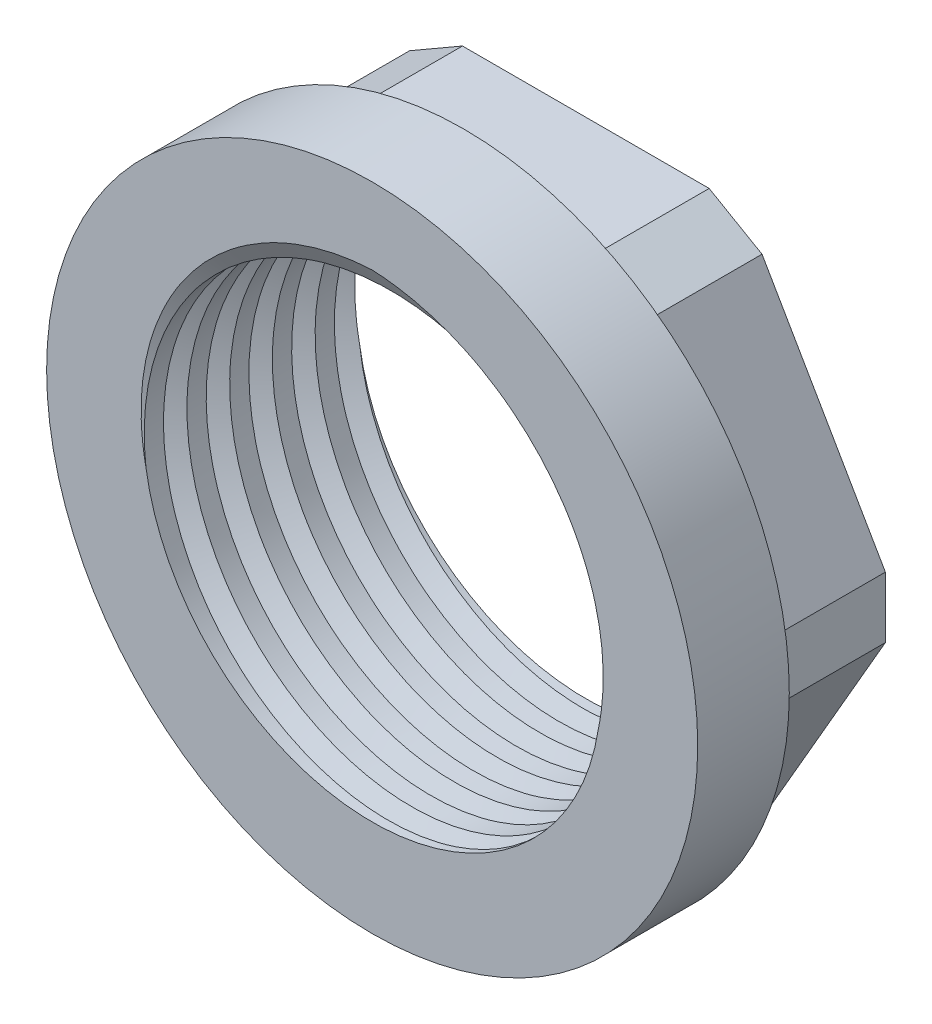
from build123d import *

# Parameters (mm, degrees)
SALIENTE_EXTRUIR1_DEPTH = 6
CROQUIS2_R              = 16
SALIENTE_EXTRUIR2_DEPTH = 4.5
CROQUIS3_R              = 11.25
CORTAR_EXTRUIR1_DEPTH   = 34.5
CORTAR_BARRER1_PITCH    = 2.1


with BuildPart() as part:
    # Croquis1 → Saliente-Extruir1 (new body)
    with BuildSketch(Plane.XY):
        Polygon((7.794228634, 13.5), (-7.794228634, 13.5), (-15.588457268, 0), (-7.794228634, -13.5), (7.794228634, -13.5), (15.588457268, 0), align=None)
    extrude(amount=SALIENTE_EXTRUIR1_DEPTH)

    # Chaflán1
    # the kernel refuses this chamfer: 3 mm, written as the material it takes off along each edge
    with BuildSketch(Plane(origin=(7.794228634, 13.5, -4.592385001), x_dir=(-1, 0, 0), z_dir=(0, 0, 1))) as chafl_n1_piece_1:
        with BuildLine():
            Line((1.835973856, -0.06), (-0.969948452, 1.56))
            Line((-0.969948452, 1.56), (-1.021909976, 1.53))
            ThreePointArc((-1.021909976, 1.53), (-0.510954988, 0.765), (-0.051961524, -0.03))
            Line((-0.051961524, -0.03), (0, -0.06))
            ThreePointArc((0, -0.06), (0.917986928, -0.06), (1.835973856, -0.12))
            Line((1.835973856, -0.12), (1.835973856, -0.06))
        make_face()
    extrude(amount=15.184770003, mode=Mode.SUBTRACT)

    # Chaflán2
    # the kernel refuses this chamfer: 3 mm, written as the material it takes off along each edge
    with BuildSketch(Plane(origin=(15.588457268, 0, -4.592385001), x_dir=(-0.49999999999999967, 0.8660254037844387, 0), z_dir=(0, 0, 1)), Plane(origin=(7.794228634, -13.5, -4.592385001), x_dir=(0.5000000000000002, 0.8660254037844385, 0), z_dir=(0, 0, 1)), Plane(origin=(-7.794228634, -13.5, -4.592385001), x_dir=(1, 0, 0), z_dir=(0, 0, 1))) as chafl_n2_piece_1:
        with BuildLine():
            Line((1.835973856, -0.06), (-0.969948452, 1.56))
            Line((-0.969948452, 1.56), (-1.021909976, 1.53))
            ThreePointArc((-1.021909976, 1.53), (-0.510954988, 0.765), (-0.051961524, -0.03))
            Line((-0.051961524, -0.03), (0, -0.06))
            ThreePointArc((0, -0.06), (0.917986928, -0.06), (1.835973856, -0.12))
            Line((1.835973856, -0.12), (1.835973856, -0.06))
        make_face()
    extrude(amount=15.184770003, mode=Mode.SUBTRACT)
    with BuildSketch(Plane(origin=(-15.588457268, 0, -4.592385001), x_dir=(0.49999999999999956, 0.8660254037844389, 0), z_dir=(0, 0, 1)), Plane(origin=(-7.794228634, 13.5, -4.592385001), x_dir=(1, 0, 0), z_dir=(0, 0, 1))) as chafl_n2_piece_2:
        with BuildLine():
            Line((1.835973856, 0.06), (-0.969948452, -1.56))
            Line((-0.969948452, -1.56), (-1.021909976, -1.53))
            ThreePointArc((-1.021909976, -1.53), (-0.510954988, -0.765), (-0.051961524, 0.03))
            Line((-0.051961524, 0.03), (0, 0.06))
            ThreePointArc((0, 0.06), (0.917986928, 0.06), (1.835973856, 0.12))
            Line((1.835973856, 0.12), (1.835973856, 0.06))
        make_face()
    extrude(amount=15.184770003, mode=Mode.SUBTRACT)

    # Croquis2 → Saliente-Extruir2 (add)
    with BuildSketch(Plane.XY.offset(6)):
        Circle(CROQUIS2_R)
    extrude(amount=SALIENTE_EXTRUIR2_DEPTH)

    # Croquis3 → Cortar-Extruir1 (cut)
    with BuildSketch(Plane(origin=(0, 0, 0), x_dir=(-1, 0, 0), z_dir=(0, 0, -1))):
        Circle(CROQUIS3_R)
    extrude(amount=-CORTAR_EXTRUIR1_DEPTH, mode=Mode.SUBTRACT)

    # Cortar-Barrer1: arcs per turn and ends read off the stored shape
    # Cortar-Barrer1: the profile of Croquis4 screwed along a right-hand helix through 6.6 turns, 10 arcs to a turn; built about Z, then put on its axis
    cortar_barrer1_z = Axis((0, 0, 0), (0, 0, 1))
    cortar_barrer1_corners = [(12.25, 0, -2.1), (10.75, 0, -2.966025404), (10.75, 0, -1.233974596)]
    with BuildLine(mode=Mode.PRIVATE) as cortar_barrer1_profile:
        Line(cortar_barrer1_corners[0], cortar_barrer1_corners[1])
        Line(cortar_barrer1_corners[1], cortar_barrer1_corners[2])
        Line(cortar_barrer1_corners[2], cortar_barrer1_corners[0])
    cortar_barrer1_cap = Face(cortar_barrer1_profile.wire())
    cortar_barrer1_turn_angles = [0, 18, 36, 54, 72, 90, 108, 126, 144, 162, 180, 198, 216, 234, 252, 270, 288, 306, 324, 342, 360]
    cortar_barrer1_turn_weights = [1, 0.9510565162951535, 1, 0.9510565162951535, 1, 0.9510565162951535, 1, 0.9510565162951535, 1, 0.9510565162951535, 1, 0.9510565162951535, 1, 0.9510565162951535, 1, 0.9510565162951535, 1, 0.9510565162951535, 1, 0.9510565162951535, 1]
    cortar_barrer1_turn_rails = [Edge.make_bspline([Vector(p[0], p[1], 0).rotate(cortar_barrer1_z, cortar_barrer1_turn_angles[k]) / cortar_barrer1_turn_weights[k] + Vector(0, 0, p[2] + CORTAR_BARRER1_PITCH * cortar_barrer1_turn_angles[k] / 360) for k in range(21)], [0, 0, 0, 1, 1, 2, 2, 3, 3, 4, 4, 5, 5, 6, 6, 7, 7, 8, 8, 9, 9, 10, 10, 10], 2, cortar_barrer1_turn_weights) for p in cortar_barrer1_corners]
    cortar_barrer1_turn_sides = [Face.make_surface_from_curves(cortar_barrer1_turn_rails[p[0]], cortar_barrer1_turn_rails[p[1]]) for p in [(0, 1), (1, 2), (2, 0)]]
    cortar_barrer1_last_angles = [2160, 2178, 2196, 2214, 2232, 2250, 2268, 2286, 2304, 2322, 2340, 2358, 2376]
    cortar_barrer1_last_weights = [1, 0.9510565162951535, 1, 0.9510565162951535, 1, 0.9510565162951535, 1, 0.9510565162951535, 1, 0.9510565162951535, 1, 0.9510565162951535, 1]
    cortar_barrer1_last_rails = [Edge.make_bspline([Vector(p[0], p[1], 0).rotate(cortar_barrer1_z, cortar_barrer1_last_angles[k]) / cortar_barrer1_last_weights[k] + Vector(0, 0, p[2] + CORTAR_BARRER1_PITCH * cortar_barrer1_last_angles[k] / 360) for k in range(13)], [0, 0, 0, 1, 1, 2, 2, 3, 3, 4, 4, 5, 5, 6, 6, 6], 2, cortar_barrer1_last_weights) for p in cortar_barrer1_corners]
    cortar_barrer1_last_sides = [Face.make_surface_from_curves(cortar_barrer1_last_rails[p[0]], cortar_barrer1_last_rails[p[1]]) for p in [(0, 1), (1, 2), (2, 0)]]
    cortar_barrer1 = Plane(origin=(0, 0, 10.5), x_dir=(0, 1, 0), z_dir=(0, 0, -1)) * Solid(Shell([*[p.moved(Location((0, 0, CORTAR_BARRER1_PITCH * i))) for i in range(6) for p in cortar_barrer1_turn_sides], *cortar_barrer1_last_sides, cortar_barrer1_cap, cortar_barrer1_cap.rotate(cortar_barrer1_z, 2376).moved(Location((0, 0, CORTAR_BARRER1_PITCH * 2376 / 360)))]))
    add(cortar_barrer1, mode=Mode.SUBTRACT)


solid = part.part
